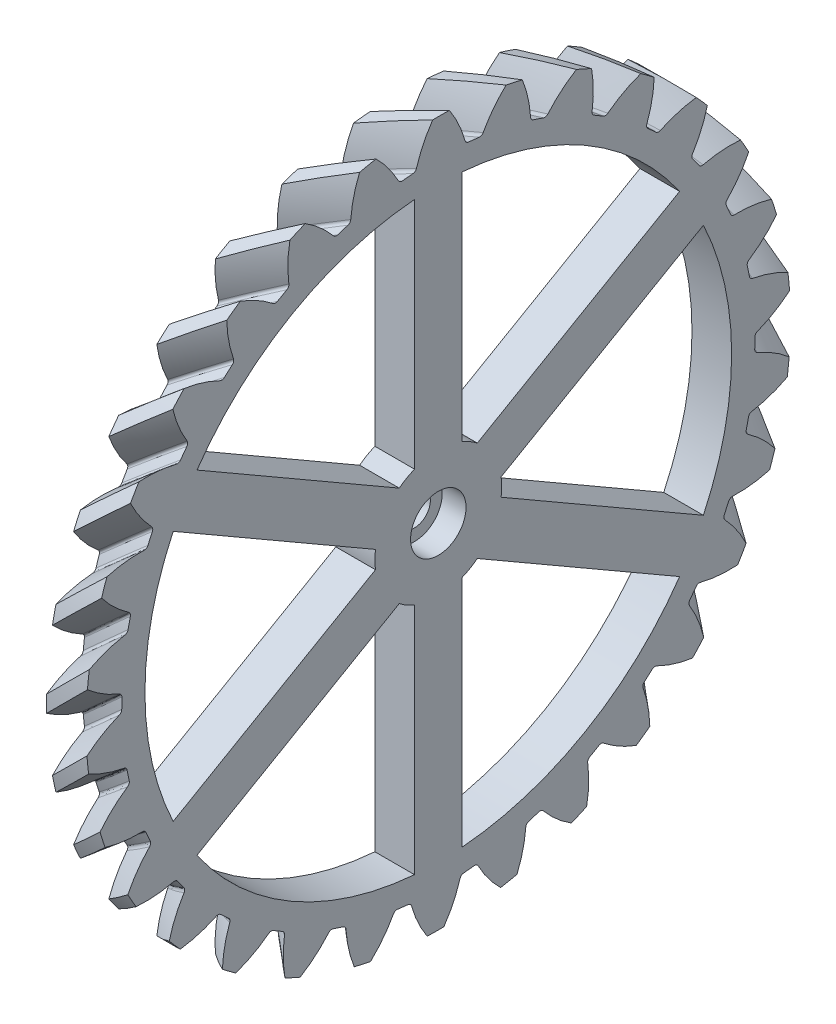
from build123d import *

# Parameters (mm, degrees)
BASPROSKE_W            = 5
BASPROSKE_H            = 44.426406871
TOOTHCUTLH_PITCH       = 279.139346904
TOOTHCUTLH_HEIGHT      = 5
TOOTHCUTLH_RADIUS      = 44.426406871
TOOTHCUTLH_START_ANGLE = -90
TEETHCUTSLH_COUNT      = 30
TEETHCUTSLH_ANGLE      = 348
BORSKE_R               = 2
BORE_DEPTH             = 62.5000025
CUT_EXTRUDE1_DEPTH     = 64.027067786
SKETCH4_R              = 3.5
CUT_EXTRUDE2_DEPTH     = 3


with BuildPart() as part:
    # BasProSke → Base-Revolve (revolve)
    with BuildSketch(Plane(origin=(0, 0, 0), x_dir=(1, 0, 0), z_dir=(0, 1, 0)), mode=Mode.PRIVATE) as base_revolve_sk:
        with Locations((2.5, 22.213203436)):
            Rectangle(BASPROSKE_W, BASPROSKE_H)
    revolve(base_revolve_sk.sketch.rotate(Axis((-10, 0, 0), (1, 0, 0)), 180), axis=Axis((-10, 0, 0), (1, 0, 0)))

    # ToothCutLH: sweep along a helix
    with BuildLine() as toothcutlh_path:
        add(Helix(TOOTHCUTLH_PITCH, TOOTHCUTLH_HEIGHT, TOOTHCUTLH_RADIUS, center=(0, 0, 0), direction=(1, 0, 0), lefthand=True, mode=Mode.PRIVATE).rotate(Axis((0, 0, 0), (1, 0, 0)), TOOTHCUTLH_START_ANGLE))
    # TooCutSkeRH<3> → ToothCutLH (sweep, cut)
    with BuildSketch(Plane(origin=(0, 0, 0), x_dir=(0, 0, -1), z_dir=(1, 0, 0))):
        with BuildLine():
            ThreePointArc((0.674771651, 39.920704514), (0, 39.926406871), (-0.674771651, 39.920704514))
            ThreePointArc((-0.674771651, 39.920704514), (-0.959539705, 40.003710983), (-1.147456491, 40.233210873))
            ThreePointArc((-1.147456491, 40.233210873), (-2.669863833, 43.066883511), (-4.761440589, 45.510800737))
            ThreePointArc((-4.761440589, 45.510800737), (0, 45.759199077), (4.761440589, 45.510800737))
            ThreePointArc((4.761440589, 45.510800737), (2.669863833, 43.066883511), (1.147456491, 40.233210873))
            ThreePointArc((1.147456491, 40.233210873), (0.959539705, 40.003710983), (0.674771651, 39.920704514))
        make_face()
    toothcutlh = sweep(path=toothcutlh_path.line, is_frenet=True, mode=Mode.SUBTRACT)

    # TeethCutsLH: ToothCutLH ×30 about axis
    teethcutslh_axis = Axis((-10, 0, 0), (1, 0, 0))
    for i in range(1, TEETHCUTSLH_COUNT):
        add(toothcutlh.rotate(teethcutslh_axis, i * TEETHCUTSLH_ANGLE / (TEETHCUTSLH_COUNT - 1)), mode=Mode.SUBTRACT)

    # BorSke → Bore (cut, symmetric)
    with BuildSketch(Plane(origin=(0, 0, 0), x_dir=(0, 0, -1), z_dir=(1, 0, 0))):
        with Locations(Location((0, 0, 0), (0, 0, 180))):
            Circle(BORSKE_R)
    extrude(amount=BORE_DEPTH, both=True, mode=Mode.SUBTRACT)

    # Sketch3 → Cut-Extrude1 (cut, through all)
    with BuildSketch(Plane(origin=(5, 0, 0), x_dir=(0, 0, -1), z_dir=(1, 0, 0))):
        with BuildLine():
            Line((-4.922616289, 6.306175455), (-30.437438845, 21.037165126))
            ThreePointArc((-30.437438845, 21.037165126), (-18.5, 32.04293994), (-3, 36.878177829))
            Line((-3, 36.878177829), (-3, 7.416198487))
            ThreePointArc((-3, 7.416198487), (-4, 6.92820323), (-4.922616289, 6.306175455))
        make_face()
        with BuildLine():
            Line((3, 7.416198487), (3, 36.878177829))
            ThreePointArc((3, 36.878177829), (18.5, 32.04293994), (30.437438845, 21.037165126))
            Line((30.437438845, 21.037165126), (4.922616289, 6.306175455))
            ThreePointArc((4.922616289, 6.306175455), (4, 6.92820323), (3, 7.416198487))
        make_face()
        with BuildLine():
            Line((7.922616289, 1.110023032), (33.437438845, 15.841012703))
            ThreePointArc((33.437438845, 15.841012703), (37, 0), (33.437438845, -15.841012703))
            Line((33.437438845, -15.841012703), (7.922616289, -1.110023032))
            ThreePointArc((7.922616289, -1.110023032), (8, 0), (7.922616289, 1.110023032))
        make_face()
        with BuildLine():
            Line((4.922616289, -6.306175455), (30.437438845, -21.037165126))
            ThreePointArc((30.437438845, -21.037165126), (18.5, -32.04293994), (3, -36.878177829))
            Line((3, -36.878177829), (3, -7.416198487))
            ThreePointArc((3, -7.416198487), (4, -6.92820323), (4.922616289, -6.306175455))
        make_face()
        with BuildLine():
            Line((-3, -7.416198487), (-3, -36.878177829))
            ThreePointArc((-3, -36.878177829), (-18.5, -32.04293994), (-30.437438845, -21.037165126))
            Line((-30.437438845, -21.037165126), (-4.922616289, -6.306175455))
            ThreePointArc((-4.922616289, -6.306175455), (-4, -6.92820323), (-3, -7.416198487))
        make_face()
        with BuildLine():
            Line((-7.922616289, -1.110023032), (-33.437438845, -15.841012703))
            ThreePointArc((-33.437438845, -15.841012703), (-37, 0), (-33.437438845, 15.841012703))
            Line((-33.437438845, 15.841012703), (-7.922616289, 1.110023032))
            ThreePointArc((-7.922616289, 1.110023032), (-8, 0), (-7.922616289, -1.110023032))
        make_face()
    extrude(amount=-CUT_EXTRUDE1_DEPTH, mode=Mode.SUBTRACT)

    # Sketch4 → Cut-Extrude2 (cut)
    with BuildSketch(Plane(origin=(5, 0, 0), x_dir=(0, 0, -1), z_dir=(1, 0, 0))):
        Circle(SKETCH4_R)
    extrude(amount=-CUT_EXTRUDE2_DEPTH, mode=Mode.SUBTRACT)


solid = part.part
